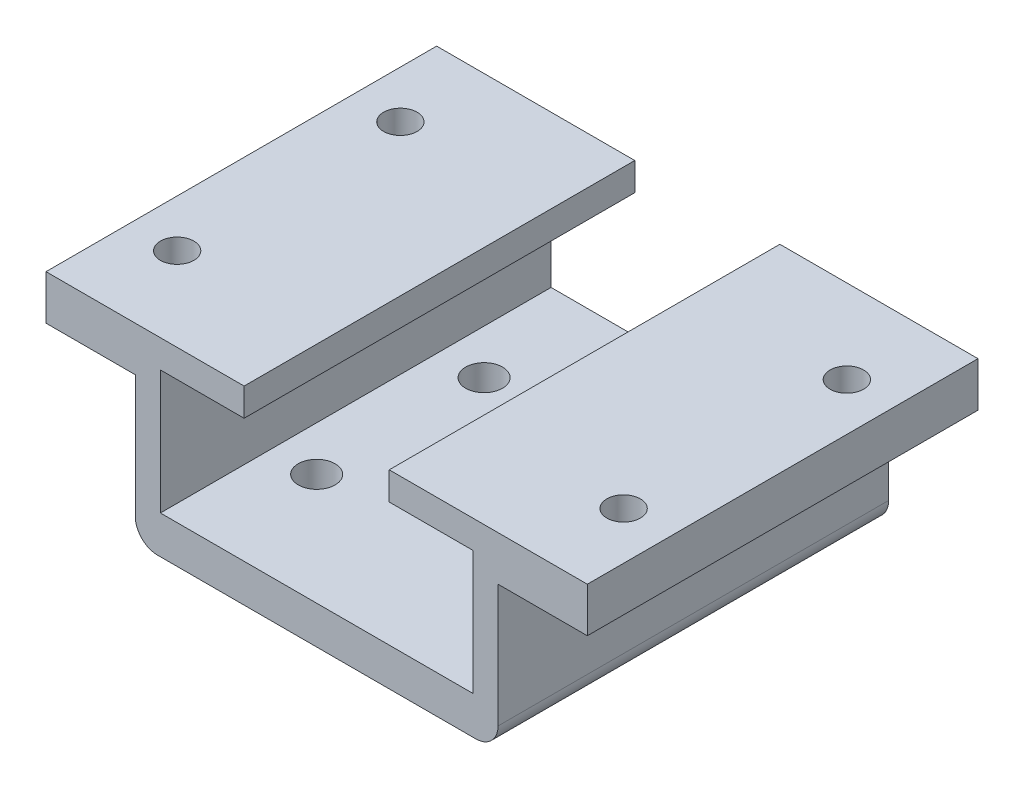
from build123d import *

# Parameters (mm, degrees)
SKETCH_1_W          = 32.5
SKETCH_1_H          = 35
EXTRUDE_1_DEPTH     = 17
CUT_EXTRUDE_2_DEPTH = 43.167078391
CUT_EXTRUDE_3_REACH = 31.314
SKETCH_4_R          = 1.65
FILLET_1_R          = 2
SKETCH_6_W          = 35
SKETCH_6_H          = 4
EXTRUDE_2_DEPTH     = 8
SKETCH_8_R          = 1.5
CUT_EXTRUDE_4_DEPTH = 35.399309586


with BuildPart() as part:
    # 草图1 → 凸台-拉伸1 (new body)
    with BuildSketch(Plane(origin=(0, 0, 0), x_dir=(1, 0, 0), z_dir=(0, 1, 0))):
        Rectangle(SKETCH_1_W, SKETCH_1_H)
    extrude(amount=EXTRUDE_1_DEPTH)

    # 草图2 → 切除-拉伸2 (cut, through all)
    with BuildSketch(Plane(origin=(0, 0, -17.5), x_dir=(-1, 0, 0), z_dir=(0, 0, -1))):
        Polygon((-6.5, 17), (-6.5, 14.5), (-14, 14.5), (-14, 3.4), (14, 3.4), (14, 14.5), (6.5, 14.5), (6.5, 17), align=None)
    extrude(amount=-CUT_EXTRUDE_2_DEPTH, mode=Mode.SUBTRACT)

    # 草图4 → 切除-拉伸3 (cut, up to next)
    with BuildSketch(Plane.XZ, mode=Mode.PRIVATE) as cut_extrude_3_sk1:
        with Locations((-10, 7.5)):
            Circle(SKETCH_4_R)
    cut_extrude_3_tool1 = extrude(cut_extrude_3_sk1.sketch, amount=-CUT_EXTRUDE_3_REACH, mode=Mode.PRIVATE) & part.part
    # 草图4 → 切除-拉伸3 (cut, up to next)
    with BuildSketch(Plane.XZ, mode=Mode.PRIVATE) as cut_extrude_3_sk2:
        with Locations((10, 7.5)):
            Circle(SKETCH_4_R)
    cut_extrude_3_tool2 = extrude(cut_extrude_3_sk2.sketch, amount=-CUT_EXTRUDE_3_REACH, mode=Mode.PRIVATE) & part.part
    # 草图4 → 切除-拉伸3 (cut, up to next)
    with BuildSketch(Plane.XZ, mode=Mode.PRIVATE) as cut_extrude_3_sk3:
        with Locations((10, -7.5)):
            Circle(SKETCH_4_R)
    cut_extrude_3_tool3 = extrude(cut_extrude_3_sk3.sketch, amount=-CUT_EXTRUDE_3_REACH, mode=Mode.PRIVATE) & part.part
    # 草图4 → 切除-拉伸3 (cut, up to next)
    with BuildSketch(Plane.XZ, mode=Mode.PRIVATE) as cut_extrude_3_sk4:
        with Locations((-10, -7.5)):
            Circle(SKETCH_4_R)
    cut_extrude_3_tool4 = extrude(cut_extrude_3_sk4.sketch, amount=-CUT_EXTRUDE_3_REACH, mode=Mode.PRIVATE) & part.part
    add(cut_extrude_3_tool1.solids().sort_by_distance((-10, 0, 7.5))[0], mode=Mode.SUBTRACT)
    add(cut_extrude_3_tool2.solids().sort_by_distance((10, 0, 7.5))[0], mode=Mode.SUBTRACT)
    add(cut_extrude_3_tool3.solids().sort_by_distance((10, 0, -7.5))[0], mode=Mode.SUBTRACT)
    add(cut_extrude_3_tool4.solids().sort_by_distance((-10, 0, -7.5))[0], mode=Mode.SUBTRACT)

    # 圆角1
    fillet_1_edges = [part.edges().sort_by_distance(p)[0] for p in [
        (16.25, 0, 0),
        (-16.25, 0, 0),
    ]]
    fillet(fillet_1_edges, radius=FILLET_1_R)

    # 草图6 → 凸台-拉伸2 (add)
    with BuildSketch(Plane.ZY.offset(16.25)):
        with Locations((0, 15)):
            Rectangle(SKETCH_6_W, SKETCH_6_H)
    extrude_2 = extrude(amount=EXTRUDE_2_DEPTH)

    # 镜向1: 凸台-拉伸2 across plane
    add(extrude_2.mirror(Plane(origin=(0, 0, 0), x_dir=(0, 0, 1), z_dir=(1, 0, 0))))

    # 草图8 → 切除-拉伸4 (cut, through all)
    with BuildSketch(Plane(origin=(0, 17, 0), x_dir=(1, 0, 0), z_dir=(0, 1, 0))):
        with Locations((-20, 10)):
            Circle(SKETCH_8_R)
        with Locations((20, 10)):
            Circle(SKETCH_8_R)
        with Locations((20, -10)):
            Circle(SKETCH_8_R)
        with Locations((-20, -10)):
            Circle(SKETCH_8_R)
    extrude(amount=-CUT_EXTRUDE_4_DEPTH, mode=Mode.SUBTRACT)


solid = part.part
